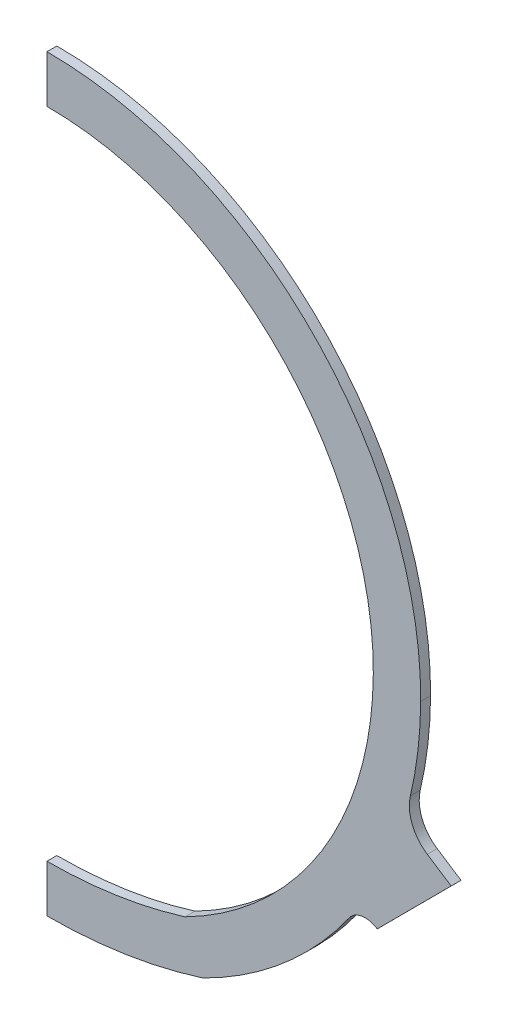
from build123d import *

# Parameters (mm, degrees)
BOSS_EXTRUDE1_DEPTH = 1.5875
SKETCH3_W           = 208.645691316
SKETCH3_H           = 383.026987577
CUT_EXTRUDE1_DEPTH  = 184.927178997
BOSS_EXTRUDE2_DEPTH = 1.5875
FILLET1_R           = 6.35
FILLET2_R           = 12.7


with BuildPart() as part:
    # Sketch2 → Boss-Extrude1 (new, symmetric)
    with BuildSketch(Plane.XY):
        with BuildLine():
            ThreePointArc((-120.098895727, 19.05), (0.406748907, 139.2017743), (120.203613722, 18.343301545))
            ThreePointArc((120.203613722, 18.343301545), (101.067699546, -47.629728931), (50.138751442, -93.726))
            ThreePointArc((50.138751442, -93.726), (0.040174098, -101.514794876), (-50.058403246, -93.726))
            ThreePointArc((-50.058403246, -93.726), (-101.163912713, -47.327889321), (-120.098895727, 19.05))
        make_face()
        with BuildLine():
            ThreePointArc((-104.858895727, 19.05), (0.361930242, 123.961840203), (104.963877332, 18.432938489))
            ThreePointArc((104.963877332, 18.432938489), (88.446745877, -39.065849025), (44.40486057, -79.553359885))
            ThreePointArc((44.40486057, -79.553359885), (0.040463589, -86.274794876), (-44.323959374, -79.553531384))
            ThreePointArc((-44.323959374, -79.553531384), (-88.517658334, -38.801393502), (-104.858895727, 19.05))
        make_face(mode=Mode.SUBTRACT)
    extrude(amount=BOSS_EXTRUDE1_DEPTH, both=True)

    # Sketch3 → Cut-Extrude1 (cut, through all)
    with BuildSketch(Plane(origin=(0, 0, 0), x_dir=(0, 0, -1), z_dir=(1, 0, 0))):
        with Locations((4.266053154, 20.866300598)):
            Rectangle(SKETCH3_W, SKETCH3_H)
    extrude(amount=-CUT_EXTRUDE1_DEPTH, mode=Mode.SUBTRACT)

    # Sketch5 → Boss-Extrude2 (add, symmetric)
    with BuildSketch(Plane.XY):
        Polygon((106.258152496, -51.988683319), (130.011728615, -28.168431361), (114.573822099, -18.142937646), (100.046993583, -49.235229101), align=None)
    extrude(amount=BOSS_EXTRUDE2_DEPTH, both=True)

    # Fillet1
    fillet1_edges = [part.edges().sort_by_distance(p)[0] for p in [
        (100.046993583, -49.235229101, 0),
    ]]
    fillet(fillet1_edges, radius=FILLET1_R)

    # Fillet2
    fillet2_edges = [part.edges().sort_by_distance(p)[0] for p in [
        (114.573822099, -18.142937646, 0),
    ]]
    fillet(fillet2_edges, radius=FILLET2_R)


solid = part.part
